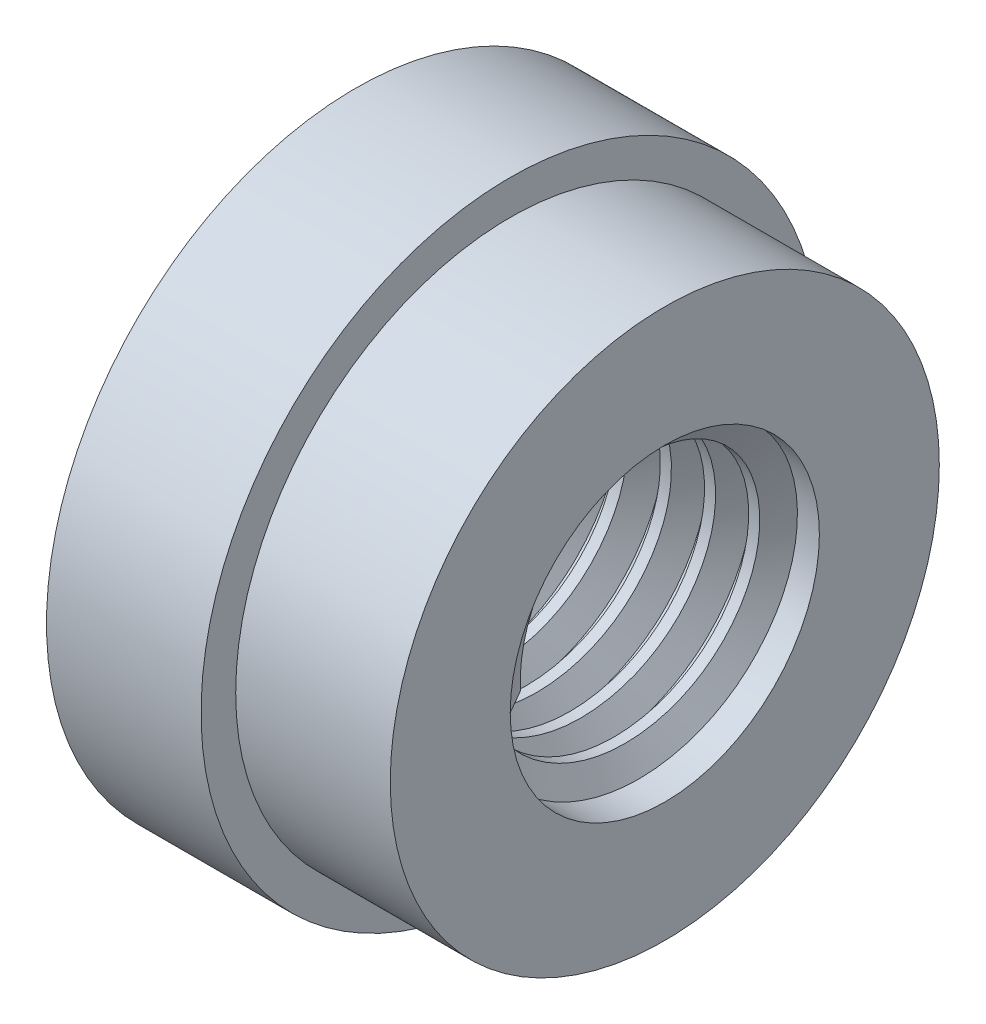
from build123d import *

# Parameters (mm, degrees)
SKETCH1_R           = 6.35
BOSS_EXTRUDE1_DEPTH = 3.175
SKETCH2_R           = 5.6388
BOSS_EXTRUDE2_DEPTH = 3.175
SKETCH3_R           = 3.175
CUT_EXTRUDE1_DEPTH  = 11.998523
THREAD2_PITCH       = 0.907143
THREAD2_TO          = 6.35


with BuildPart() as part:
    # Sketch1 → Boss-Extrude1 (new body)
    with BuildSketch(Plane(origin=(0, 0, 0), x_dir=(0, 0, -1), z_dir=(1, 0, 0))):
        Circle(SKETCH1_R)
    extrude(amount=BOSS_EXTRUDE1_DEPTH)

    # Sketch2 → Boss-Extrude2 (add)
    with BuildSketch(Plane(origin=(3.175, 0, 0), x_dir=(0, 0, -1), z_dir=(1, 0, 0))):
        Circle(SKETCH2_R)
    extrude(amount=BOSS_EXTRUDE2_DEPTH)

    # Sketch3 → Cut-Extrude1 (cut, through all)
    with BuildSketch(Plane(origin=(6.35, 0, 0), x_dir=(0, 0, -1), z_dir=(1, 0, 0))):
        Circle(SKETCH3_R)
    extrude(amount=-CUT_EXTRUDE1_DEPTH, mode=Mode.SUBTRACT)

    # Thread2: arcs per turn and ends read off the stored shape
    # Thread2: the profile of Thread Profile3 profile screwed along a right-hand helix through 7 turns, 8 arcs to a turn; built about Z, then put on its axis
    thread2_z = Axis((0, 0, 0), (0, 0, 1))
    thread2_corners = [(3.1753, 0, -0.000173), (3.1753, 0, 0.793923), (2.683995, 0, 0.510268), (2.683995, 0, 0.283482)]
    with BuildLine(mode=Mode.PRIVATE) as thread2_profile:
        Line(thread2_corners[0], thread2_corners[1])
        Line(thread2_corners[1], thread2_corners[2])
        Line(thread2_corners[2], thread2_corners[3])
        Line(thread2_corners[3], thread2_corners[0])
    thread2_cap = Face(thread2_profile.wire())
    thread2_turn_angles = [0, 22.5, 45, 67.5, 90, 112.5, 135, 157.5, 180, 202.5, 225, 247.5, 270, 292.5, 315, 337.5, 360]
    thread2_turn_weights = [1, 0.9238795325112867, 1, 0.9238795325112867, 1, 0.9238795325112867, 1, 0.9238795325112867, 1, 0.9238795325112867, 1, 0.9238795325112867, 1, 0.9238795325112867, 1, 0.9238795325112867, 1]
    thread2_turn_rails = [Edge.make_bspline([Vector(p[0], p[1], 0).rotate(thread2_z, thread2_turn_angles[k]) / thread2_turn_weights[k] + Vector(0, 0, p[2] + THREAD2_PITCH * thread2_turn_angles[k] / 360) for k in range(17)], [0, 0, 0, 1, 1, 2, 2, 3, 3, 4, 4, 5, 5, 6, 6, 7, 7, 8, 8, 8], 2, thread2_turn_weights) for p in thread2_corners]
    thread2_turn_sides = [Face.make_surface_from_curves(thread2_turn_rails[p[0]], thread2_turn_rails[p[1]]) for p in [(0, 1), (1, 2), (2, 3), (3, 0)]]
    thread2 = Plane(origin=(6.35, 0, 0), x_dir=(0, 0, 1), z_dir=(-1, 0, 0)) * split(Solid(Shell([*[p.moved(Location((0, 0, THREAD2_PITCH * i))) for i in range(7) for p in thread2_turn_sides], thread2_cap, thread2_cap.rotate(thread2_z, 2520).moved(Location((0, 0, THREAD2_PITCH * 2520 / 360)))])), bisect_by=Plane.XY.offset(THREAD2_TO), keep=Keep.BOTTOM, mode=Mode.PRIVATE)
    add(thread2)


solid = part.part
